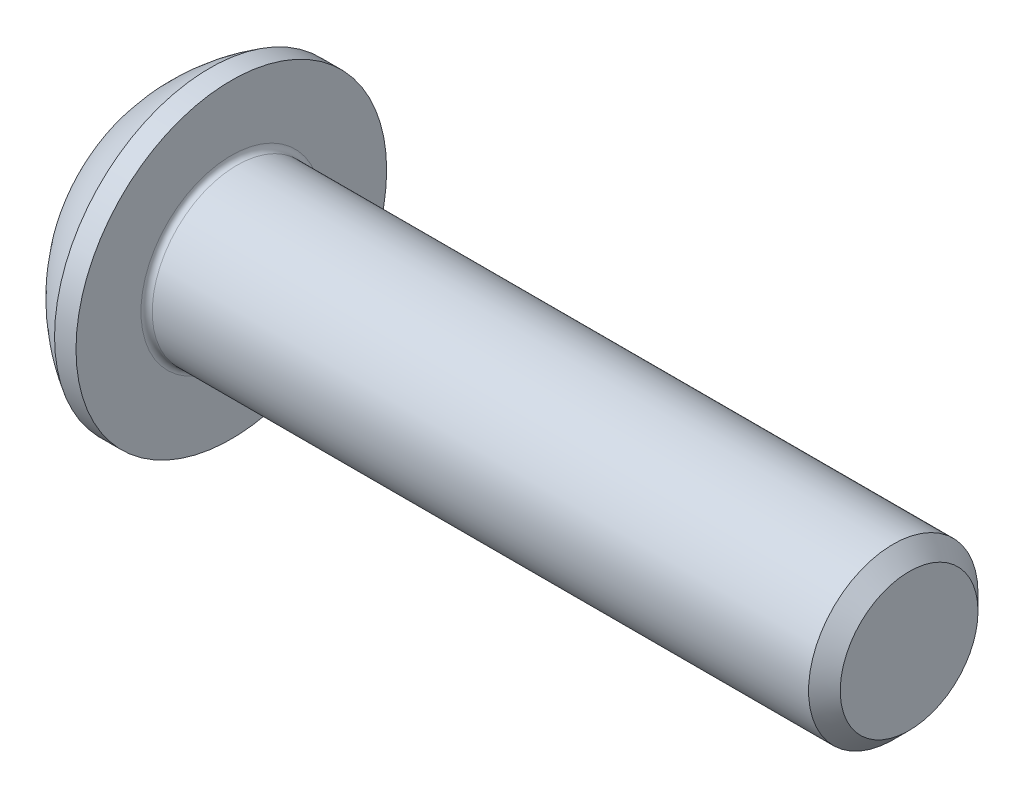
from build123d import *

# Parameters (mm, degrees)
CUT_EXTRUDE1_DEPTH        = 1.04
SKETCH4_R                 = 1.5
LARGO_Y_ANCHO_ROSCA_DEPTH = 12
FILLET1_R                 = 0.1
CHAMFER1_SIZE             = 0.2805


with BuildPart() as part:
    # Sketch1 → Revolve1 (revolve)
    with BuildSketch(Plane(origin=(0, 0, 0), x_dir=(-1, 0, 0), z_dir=(0, 0, -1))):
        with BuildLine():
            Line((-1.65, 2.75), (-1.65, 0))
            Line((-1.65, 0), (0, 0))
            Line((0, 0), (0, 1.425))
            ThreePointArc((0, 1.425), (-0.542530893, 2.176130767), (-1.27, 2.75))
            Line((-1.27, 2.75), (-1.65, 2.75))
        make_face()
    revolve(axis=Axis((1.65, 0, 0), (-1, 0, 0)))

    # Sketch2 → Cut-Extrude1 (cut)
    with BuildSketch(Plane.ZY):
        Polygon((-1, 0.577350269), (-1, -0.577350269), (0, -1.154700538), (1, -0.577350269), (1, 0.577350269), (0, 1.154700538), align=None)
    extrude(amount=-CUT_EXTRUDE1_DEPTH, mode=Mode.SUBTRACT)

    # Sketch3 → Cut-Revolve1 (revolve, cut)
    with BuildSketch(Plane.XY):
        Polygon((1.04, 1), (1.04, 0), (1.617350269, 0), align=None)
    revolve(axis=Axis((1.04, 0, 0), (1, 0, 0)), mode=Mode.SUBTRACT)

    # Sketch4 → Largo y Ancho rosca (add)
    with BuildSketch(Plane(origin=(1.65, 0, 0), x_dir=(0, 0, -1), z_dir=(1, 0, 0))):
        Circle(SKETCH4_R)
    extrude(amount=LARGO_Y_ANCHO_ROSCA_DEPTH)

    # Fillet1
    fillet1_edges = [part.edges().sort_by_distance(p)[0] for p in [
        (1.65, 0, 1.5),
    ]]
    fillet(fillet1_edges, radius=FILLET1_R)

    # Chamfer1
    chamfer1_edges = [part.edges().sort_by_distance(p)[0] for p in [
        (13.65, 0, 1.5),
    ]]
    chamfer(chamfer1_edges, length=CHAMFER1_SIZE)


solid = part.part
